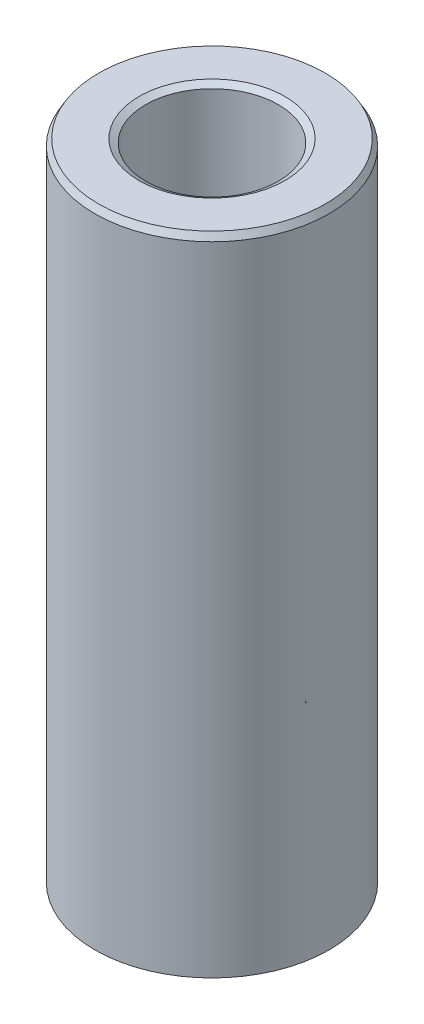
from build123d import *
from OCP.BRepFilletAPI import BRepFilletAPI_MakeChamfer

# Parameters (mm, degrees)
SKETCH1_R           = 57.5
BOSS_EXTRUDE1_DEPTH = 317.978610314
SKETCH2_R           = 32.573451901
CUT_EXTRUDE1_DEPTH  = 329.211664353
CHAMFER1_SIZE       = 3.223101777
CHAMFER1_SIZE2      = 1.860858679


with BuildPart() as part:
    # Sketch1 → Boss-Extrude1 (new body)
    with BuildSketch(Plane(origin=(0, 0, 0), x_dir=(1, 0, 0), z_dir=(0, 1, 0))):
        Circle(SKETCH1_R)
    extrude(amount=BOSS_EXTRUDE1_DEPTH)

    # Sketch2 → Cut-Extrude1 (cut, through all)
    with BuildSketch(Plane(origin=(0, 0, 0), x_dir=(1, 0, 0), z_dir=(0, 1, 0))):
        Circle(SKETCH2_R)
    extrude(amount=CUT_EXTRUDE1_DEPTH, mode=Mode.SUBTRACT)

    # Chamfer1: one chamfer whose edges measure the first distance from different faces: ONE call of the kernel's chamfer builder (chamfer() names one face for all edges)
    chamfer1_edges_1 = [part.edges().sort_by_distance(p)[0] for p in [
        (-32.573451901, 317.978610314, 0),
    ]]
    chamfer1_side_1 = [part.faces().sort_by_distance(p)[0] for p in [
        (-55.873654403, 317.978610314, 0),
    ]]
    chamfer1_edges_2 = [part.edges().sort_by_distance(p)[0] for p in [
        (-32.573451901, 0, 0),
    ]]
    chamfer1_side_2 = [part.faces().sort_by_distance(p)[0] for p in [
        (-32.573451901, 158.989305157, 0),
    ]]
    chamfer1_edges_3 = [part.edges().sort_by_distance(p)[0] for p in [
        (-57.5, 0, 0),
    ]]
    chamfer1_side_3 = [part.faces().sort_by_distance(p)[0] for p in [
        (-55.873654403, 0, 0),
    ]]
    chamfer1_edges_4 = [part.edges().sort_by_distance(p)[0] for p in [
        (-57.5, 317.978610314, 0),
    ]]
    chamfer1_side_4 = [part.faces().sort_by_distance(p)[0] for p in [
        (-57.5, 158.989305157, 0),
    ]]
    chamfer1 = BRepFilletAPI_MakeChamfer(part.part.solid().wrapped)
    for e in chamfer1_edges_1:
        chamfer1.Add(CHAMFER1_SIZE, CHAMFER1_SIZE2, e.wrapped, chamfer1_side_1[0].wrapped)  # the first distance lies on this face
    for e in chamfer1_edges_2:
        chamfer1.Add(CHAMFER1_SIZE, CHAMFER1_SIZE2, e.wrapped, chamfer1_side_2[0].wrapped)  # the first distance lies on this face
    for e in chamfer1_edges_3:
        chamfer1.Add(CHAMFER1_SIZE, CHAMFER1_SIZE2, e.wrapped, chamfer1_side_3[0].wrapped)  # the first distance lies on this face
    for e in chamfer1_edges_4:
        chamfer1.Add(CHAMFER1_SIZE, CHAMFER1_SIZE2, e.wrapped, chamfer1_side_4[0].wrapped)  # the first distance lies on this face
    add(Compound.cast(chamfer1.Shape()), mode=Mode.REPLACE)


solid = part.part
